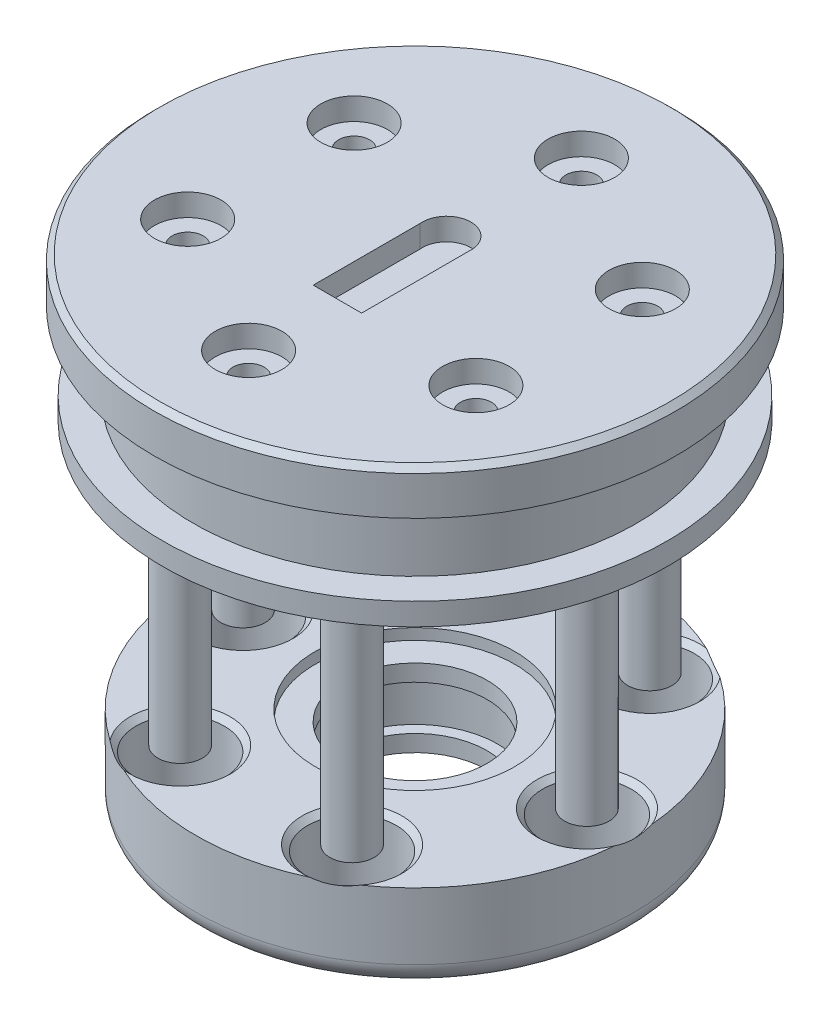
from build123d import *

# Parameters (mm, degrees)
SKETCH1_R              = 2
BOSS_EXTRUDE1_DEPTH    = 22.5
BOSS_EXTRUDE1_2_DEPTH  = 22.5
BOSS_EXTRUDE1_3_DEPTH  = 22.5
BOSS_EXTRUDE1_4_DEPTH  = 22.5
BOSS_EXTRUDE1_5_DEPTH  = 22.5
BOSS_EXTRUDE1_6_DEPTH  = 22.5
SKETCH2_R              = 19.75
SKETCH2_R_2            = 7.5
BOSS_EXTRUDE2_DEPTH    = 8
SKETCH4_R              = 7.5
SKETCH4_R_2            = 6.5
BOSS_EXTRUDE3_DEPTH    = 2.5
BOSS_EXTRUDE4_START    = -6.5
SKETCH4_2_R            = 7.5
SKETCH4_2_R_2          = 6.5
BOSS_EXTRUDE4_DEPTH    = 1.5
SKETCH5_R              = 9
CUT_EXTRUDE1_DEPTH     = 1
SKETCH6_R              = 20
BOSS_EXTRUDE5_DEPTH    = 9
SKETCH10_R             = 22.75
BOSS_EXTRUDE7_DEPTH    = 2
CUT_EXTRUDE2_START     = -4
SKETCH8_R              = 7.5
CUT_EXTRUDE2_DEPTH     = 4
SKETCH9_R              = 6
CUT_EXTRUDE3_DEPTH     = 1.5
SKETCH11_R             = 23.5
BOSS_EXTRUDE9_DEPTH    = 4
FILLET1_R              = 2
SKETCH14_R             = 4
CUT_EXTRUDE4_DEPTH     = 6
CUT_EXTRUDE6_START     = 22.5
SKETCH14_4_R           = 4
CUT_EXTRUDE6_DEPTH     = 6
CHAMFER1_SIZE          = 0.5
CHAMFER2_SIZE          = 0.5
CUT_EXTRUDE7_DEPTH     = 3
SKETCH16_R             = 1.4
CUT_EXTRUDE8_DEPTH     = 10
SKETCH17_R             = 3
CUT_EXTRUDE9_DEPTH     = 2
CIRPATTERN1_COUNT      = 6
SPLIT1_SURFACE_1_BACK  = 80.437
SPLIT1_SURFACE_1_DEPTH = 160.874
SPLIT1_SURFACE_2_BACK  = 80.437
SPLIT1_SURFACE_2_DEPTH = 160.874
CHAMFER3_SIZE          = 0.5
CUT_EXTRUDE10_DEPTH    = 2
CHAMFER4_SIZE          = 0.5
CHAMFER5_SIZE          = 0.5


with BuildPart() as part:
    # Sketch1 → Boss-Extrude1 (new body)
    with BuildSketch(Plane(origin=(0, 0, 0), x_dir=(1, 0, 0), z_dir=(0, 1, 0))):
        with Locations(Location((15.5, 0, 0), (0, 0, 90))):
            Circle(SKETCH1_R)
    extrude(amount=BOSS_EXTRUDE1_DEPTH)



with BuildPart() as body_2:
    # Sketch1 → Boss-Extrude1 2 (new body)
    with BuildSketch(Plane(origin=(0, 0, 0), x_dir=(1, 0, 0), z_dir=(0, 1, 0))):
        with Locations(Location((7.75, -13.423393759, 0), (0, 0, 90))):
            Circle(SKETCH1_R)
    extrude(amount=BOSS_EXTRUDE1_2_DEPTH)


with BuildPart() as body_3:
    # Sketch1 → Boss-Extrude1 3 (new body)
    with BuildSketch(Plane(origin=(0, 0, 0), x_dir=(1, 0, 0), z_dir=(0, 1, 0))):
        with Locations(Location((-7.75, -13.423393759, 0), (0, 0, 90))):
            Circle(SKETCH1_R)
    extrude(amount=BOSS_EXTRUDE1_3_DEPTH)


with BuildPart() as body_4:
    # Sketch1 → Boss-Extrude1 4 (new body)
    with BuildSketch(Plane(origin=(0, 0, 0), x_dir=(1, 0, 0), z_dir=(0, 1, 0))):
        with Locations(Location((-15.5, 0, 0), (0, 0, 90))):
            Circle(SKETCH1_R)
    extrude(amount=BOSS_EXTRUDE1_4_DEPTH)


with BuildPart() as body_5:
    # Sketch1 → Boss-Extrude1 5 (new body)
    with BuildSketch(Plane(origin=(0, 0, 0), x_dir=(1, 0, 0), z_dir=(0, 1, 0))):
        with Locations(Location((-7.75, 13.423393759, 0), (0, 0, 90))):
            Circle(SKETCH1_R)
    extrude(amount=BOSS_EXTRUDE1_5_DEPTH)


with BuildPart() as body_6:
    # Sketch1 → Boss-Extrude1 6 (new body)
    with BuildSketch(Plane(origin=(0, 0, 0), x_dir=(1, 0, 0), z_dir=(0, 1, 0))):
        with Locations(Location((7.75, 13.423393759, 0), (0, 0, 90))):
            Circle(SKETCH1_R)
    extrude(amount=BOSS_EXTRUDE1_6_DEPTH)


with BuildPart() as part_1:
    add(part.part)

    add(body_2.part)  # Boss-Extrude2 merges body 2

    add(body_3.part)  # Boss-Extrude2 merges body 3

    add(body_4.part)  # Boss-Extrude2 merges body 4

    add(body_5.part)  # Boss-Extrude2 merges body 5

    add(body_6.part)  # Boss-Extrude2 merges body 6
    # Sketch2 → Boss-Extrude2 (add)
    with BuildSketch(Plane.XZ):
        with Locations(Location((0, 0, 0), (0, 0, 270))):
            Circle(SKETCH2_R)
        with Locations(Location((0, 0, 0), (0, 0, 270))):
            Circle(SKETCH2_R_2, mode=Mode.SUBTRACT)
    extrude(amount=BOSS_EXTRUDE2_DEPTH)

    # Sketch4 → Boss-Extrude3 (add)
    with BuildSketch(Plane(origin=(0, 0, 0), x_dir=(1, 0, 0), z_dir=(0, 1, 0))):
        with Locations(Location((0, 0, 0), (0, 0, 270))):
            Circle(SKETCH4_R)
        with Locations(Location((0, 0, 0), (0, 0, 270))):
            Circle(SKETCH4_R_2, mode=Mode.SUBTRACT)
    extrude(amount=-BOSS_EXTRUDE3_DEPTH)

    # Sketch4<2> → Boss-Extrude4 (add)
    with BuildSketch(Plane(origin=(0, 0, 0), x_dir=(1, 0, 0), z_dir=(0, 1, 0)).offset(BOSS_EXTRUDE4_START)):
        with Locations(Location((0, 0, 0), (0, 0, 270))):
            Circle(SKETCH4_2_R)
        with Locations(Location((0, 0, 0), (0, 0, 270))):
            Circle(SKETCH4_2_R_2, mode=Mode.SUBTRACT)
    extrude(amount=-BOSS_EXTRUDE4_DEPTH)

    # Sketch5 → Cut-Extrude1 (cut)
    with BuildSketch(Plane(origin=(0, 0, 0), x_dir=(1, 0, 0), z_dir=(0, 1, 0))):
        with Locations(Location((0, 0, 0), (0, 0, 270))):
            Circle(SKETCH5_R)
    extrude(amount=-CUT_EXTRUDE1_DEPTH, mode=Mode.SUBTRACT)

    # Sketch6 → Boss-Extrude5 (add)
    with BuildSketch(Plane(origin=(0, 22.5, 0), x_dir=(1, 0, 0), z_dir=(0, 1, 0))):
        with Locations(Location((0, 0, 0), (0, 0, 270))):
            Circle(SKETCH6_R)
    extrude(amount=BOSS_EXTRUDE5_DEPTH)

    # Sketch10 → Boss-Extrude7 (add)
    with BuildSketch(Plane.XZ.offset(-22.5)):
        with Locations(Location((0, 0, 0), (0, 0, 270))):
            Circle(SKETCH10_R)
    extrude(amount=-BOSS_EXTRUDE7_DEPTH)

    # Sketch8 → Cut-Extrude2 (cut)
    with BuildSketch(Plane.XZ.offset(-22.5).offset(CUT_EXTRUDE2_START)):
        with Locations(Location((0, 0, 0), (0, 0, 90))):
            Circle(SKETCH8_R)
    extrude(amount=CUT_EXTRUDE2_DEPTH, mode=Mode.SUBTRACT)

    # Sketch9 → Cut-Extrude3 (cut)
    with BuildSketch(Plane.XZ.offset(-26.5)):
        with Locations(Location((0, 0, 0), (0, 0, 270))):
            Circle(SKETCH9_R)
    extrude(amount=-CUT_EXTRUDE3_DEPTH, mode=Mode.SUBTRACT)

    # Sketch11 → Boss-Extrude9 (add)
    with BuildSketch(Plane(origin=(0, 31.5, 0), x_dir=(1, 0, 0), z_dir=(0, 1, 0))):
        with Locations(Location((0, 0, 0), (0, 0, 270))):
            Circle(SKETCH11_R)
    extrude(amount=BOSS_EXTRUDE9_DEPTH)

    # Fillet1
    fillet1_edges = [part_1.edges().sort_by_distance(p)[0] for p in [
        (0, -8, 19.75),
    ]]
    fillet(fillet1_edges, radius=FILLET1_R)

    # Sketch14 → Cut-Extrude4 (cut)
    with BuildSketch(Plane(origin=(0, 0, 0), x_dir=(1, 0, 0), z_dir=(0, 1, 0))):
        with Locations(Location((15.5, 0, 0), (0, 0, 270))):
            Circle(SKETCH14_R)
        with Locations(Location((7.75, -13.423393759, 0), (0, 0, 270))):
            Circle(SKETCH14_R)
        with Locations(Location((-7.75, -13.423393759, 0), (0, 0, 270))):
            Circle(SKETCH14_R)
        with Locations(Location((-15.5, 0, 0), (0, 0, 270))):
            Circle(SKETCH14_R)
        with Locations(Location((-7.75, 13.423393759, 0), (0, 0, 270))):
            Circle(SKETCH14_R)
        with Locations(Location((7.75, 13.423393759, 0), (0, 0, 270))):
            Circle(SKETCH14_R)
    extrude(amount=-CUT_EXTRUDE4_DEPTH, mode=Mode.SUBTRACT)


with BuildPart() as cut_extrude4_piece_1:
    # of the separate pieces the step leaves, piece 1, a body of its own (cut_extrude4_pieces)
    add(part_1.part.solids().sort_by_distance((-7.75, 0, -15.423393759))[0])

    # Sketch14<4> → Cut-Extrude6 (cut)
    with BuildSketch(Plane(origin=(0, 0, 0), x_dir=(1, 0, 0), z_dir=(0, 1, 0)).offset(CUT_EXTRUDE6_START)):
        with Locations(Location((15.5, 0, 0), (0, 0, 270))):
            Circle(SKETCH14_4_R)
        with Locations(Location((7.75, -13.423393759, 0), (0, 0, 270))):
            Circle(SKETCH14_4_R)
        with Locations(Location((-7.75, -13.423393759, 0), (0, 0, 270))):
            Circle(SKETCH14_4_R)
        with Locations(Location((-15.5, 0, 0), (0, 0, 270))):
            Circle(SKETCH14_4_R)
        with Locations(Location((-7.75, 13.423393759, 0), (0, 0, 270))):
            Circle(SKETCH14_4_R)
        with Locations(Location((7.75, 13.423393759, 0), (0, 0, 270))):
            Circle(SKETCH14_4_R)
    extrude(amount=CUT_EXTRUDE6_DEPTH, mode=Mode.SUBTRACT)


with BuildPart() as cut_extrude4_piece_2:
    # of the separate pieces the step leaves, piece 2, a body of its own (cut_extrude4_pieces)
    add(part_1.part.solids().sort_by_distance((0, -6, -19.75))[0])

    # Chamfer1
    # the kernel refuses this chamfer: 0.5 mm, written as the material it takes off along each edge
    with BuildSketch(Plane(origin=(7.75, 0, -13.423393759), x_dir=(0, 0, 1), z_dir=(-1, 0, 0))) as chamfer1_piece_1:
        Polygon((4 + CHAMFER1_SIZE, 0), (4, -CHAMFER1_SIZE), (4, 0), align=None)
    revolve(axis=Axis((7.75, 0, -13.423393759), (0, 1, 0)), mode=Mode.SUBTRACT)
    with BuildSketch(Plane(origin=(-7.75, 0, -13.423393759), x_dir=(0, 0, 1), z_dir=(-1, 0, 0))) as chamfer1_piece_2:
        Polygon((4 + CHAMFER1_SIZE, 0), (4, -CHAMFER1_SIZE), (4, 0), align=None)
    revolve(axis=Axis((-7.75, 0, -13.423393759), (0, 1, 0)), mode=Mode.SUBTRACT)
    with BuildSketch(Plane(origin=(-15.5, 0, 0), x_dir=(0, 0, 1), z_dir=(-1, 0, 0))) as chamfer1_piece_3:
        Polygon((4 + CHAMFER1_SIZE, 0), (4, -CHAMFER1_SIZE), (4, 0), align=None)
    revolve(axis=Axis((-15.5, 0, 0), (0, 1, 0)), mode=Mode.SUBTRACT)
    with BuildSketch(Plane(origin=(-7.75, 0, 13.423393759), x_dir=(0, 0, 1), z_dir=(-1, 0, 0))) as chamfer1_piece_4:
        Polygon((4 + CHAMFER1_SIZE, 0), (4, -CHAMFER1_SIZE), (4, 0), align=None)
    revolve(axis=Axis((-7.75, 0, 13.423393759), (0, 1, 0)), mode=Mode.SUBTRACT)
    with BuildSketch(Plane(origin=(7.75, 0, 13.423393759), x_dir=(0, 0, 1), z_dir=(-1, 0, 0))) as chamfer1_piece_5:
        Polygon((4 + CHAMFER1_SIZE, 0), (4, -CHAMFER1_SIZE), (4, 0), align=None)
    revolve(axis=Axis((7.75, 0, 13.423393759), (0, 1, 0)), mode=Mode.SUBTRACT)
    with BuildSketch(Plane(origin=(15.5, 0, 0), x_dir=(0, 0, 1), z_dir=(-1, 0, 0))) as chamfer1_piece_6:
        Polygon((4 + CHAMFER1_SIZE, 0), (4, -CHAMFER1_SIZE), (4, 0), align=None)
    revolve(axis=Axis((15.5, 0, 0), (0, 1, 0)), mode=Mode.SUBTRACT)


with BuildPart() as cut_extrude6_piece_1:
    # of the separate pieces the step leaves, piece 1, a body of its own (cut_extrude6_pieces)
    add(cut_extrude4_piece_1.part.solids().sort_by_distance((0, 22.5, -22.75))[0])

    # Chamfer2
    chamfer2_edges = [cut_extrude6_piece_1.edges().sort_by_distance(p)[0] for p in [
        (-7.75, 22.5, 9.423393759),
        (-15.5, 22.5, -4),
        (-7.75, 22.5, -17.423393759),
        (7.75, 22.5, -17.423393759),
        (15.5, 22.5, -4),
        (7.75, 22.5, 9.423393759),
    ]]
    chamfer(chamfer2_edges, length=CHAMFER2_SIZE)

    # Sketch15 → Cut-Extrude7 (cut)
    with BuildSketch(Plane.XZ.offset(-22.5)):
        Polygon((9.790381057, 5.652479139), (12.990381057, 3.804958277), (16.190381057, 5.652479139), (16.190381057, 9.347520861), (12.990381057, 11.195041723), (9.790381057, 9.347520861), align=None)
    cut_extrude7 = extrude(amount=-CUT_EXTRUDE7_DEPTH, mode=Mode.SUBTRACT)

    # Sketch16 → Cut-Extrude8 (cut)
    with BuildSketch(Plane.XZ.offset(-25.5)):
        with Locations(Location((12.990381057, 7.5, 0), (0, 0, 270))):
            Circle(SKETCH16_R)
    cut_extrude8 = extrude(amount=-CUT_EXTRUDE8_DEPTH, mode=Mode.SUBTRACT)

    # Sketch17 → Cut-Extrude9 (cut)
    with BuildSketch(Plane(origin=(0, 35.5, 0), x_dir=(1, 0, 0), z_dir=(0, 1, 0))):
        with Locations(Location((12.990381057, -7.5, 0), (0, 0, 270))):
            Circle(SKETCH17_R)
    cut_extrude9 = extrude(amount=-CUT_EXTRUDE9_DEPTH, mode=Mode.SUBTRACT)

    # CirPattern1: Cut-Extrude7, Cut-Extrude8, Cut-Extrude9 ×6 about axis
    cirpattern1_axis = Axis((0, 0, 0), (0, 1, 0))
    add([cut_extrude7.rotate(cirpattern1_axis, i * 360 / CIRPATTERN1_COUNT) for i in range(1, CIRPATTERN1_COUNT)], mode=Mode.SUBTRACT)
    add([cut_extrude8.rotate(cirpattern1_axis, i * 360 / CIRPATTERN1_COUNT) for i in range(1, CIRPATTERN1_COUNT)], mode=Mode.SUBTRACT)
    add([cut_extrude9.rotate(cirpattern1_axis, i * 360 / CIRPATTERN1_COUNT) for i in range(1, CIRPATTERN1_COUNT)], mode=Mode.SUBTRACT)


with BuildPart() as cut_extrude6_piece_2:
    # of the separate pieces the step leaves, piece 2, a body of its own (cut_extrude6_pieces)
    add(cut_extrude4_piece_1.part.solids().sort_by_distance((15.5, 0, -2))[0])


with BuildPart() as cut_extrude6_piece_3:
    # of the separate pieces the step leaves, piece 3, a body of its own (cut_extrude6_pieces)
    add(cut_extrude4_piece_1.part.solids().sort_by_distance((-7.75, 0, 11.423393759))[0])


with BuildPart() as cut_extrude6_piece_4:
    # of the separate pieces the step leaves, piece 4, a body of its own (cut_extrude6_pieces)
    add(cut_extrude4_piece_1.part.solids().sort_by_distance((-7.75, 0, -15.423393759))[0])


with BuildPart() as cut_extrude6_piece_5:
    # of the separate pieces the step leaves, piece 5, a body of its own (cut_extrude6_pieces)
    add(cut_extrude4_piece_1.part.solids().sort_by_distance((7.75, 0, 11.423393759))[0])


with BuildPart() as cut_extrude6_piece_6:
    # of the separate pieces the step leaves, piece 6, a body of its own (cut_extrude6_pieces)
    add(cut_extrude4_piece_1.part.solids().sort_by_distance((7.75, 0, -15.423393759))[0])


with BuildPart() as cut_extrude6_piece_7:
    # of the separate pieces the step leaves, piece 7, a body of its own (cut_extrude6_pieces)
    add(cut_extrude4_piece_1.part.solids().sort_by_distance((-15.5, 0, -2))[0])


with BuildPart() as body_9:
    # Split1: the piece behind the surface
    add(cut_extrude6_piece_1.part)
    # Split1 surface: a surface, the sketch's curves swept straight by 160.874 mm
    with BuildLine(Plane.XY.offset(-SPLIT1_SURFACE_1_BACK), mode=Mode.PRIVATE) as split1_surface_1_path:
        Line((-58.318961136, 31.5), (42.618963332, 31.5))
    split1_surface_1 = Shell.extrude(split1_surface_1_path.wire(), (0 * SPLIT1_SURFACE_1_DEPTH, 0 * SPLIT1_SURFACE_1_DEPTH, 1 * SPLIT1_SURFACE_1_DEPTH))
    split(bisect_by=split1_surface_1, keep=Keep.BOTTOM)

    # Chamfer3
    chamfer3_edges = [body_9.edges().sort_by_distance(p)[0] for p in [
        (0, 31.5, -20),
    ]]
    chamfer(chamfer3_edges, length=CHAMFER3_SIZE)

    # Chamfer5
    chamfer5_edges = [body_9.edges().sort_by_distance(p)[0] for p in [
        (0, 22.5, -7.5),
    ]]
    chamfer(chamfer5_edges, length=CHAMFER5_SIZE)


with BuildPart() as cut_extrude6_piece_1_1:
    add(cut_extrude6_piece_1.part)

    # Split1: split by a surface, the side it looks to stays
    # Split1 surface: a surface, the sketch's curves swept straight by 160.874 mm
    with BuildLine(Plane.XY.offset(-SPLIT1_SURFACE_2_BACK), mode=Mode.PRIVATE) as split1_surface_2_path:
        Line((-58.318961136, 31.5), (42.618963332, 31.5))
    split1_surface_2 = Shell.extrude(split1_surface_2_path.wire(), (0 * SPLIT1_SURFACE_2_DEPTH, 0 * SPLIT1_SURFACE_2_DEPTH, 1 * SPLIT1_SURFACE_2_DEPTH))
    split(bisect_by=split1_surface_2, keep=Keep.TOP)

    # Sketch19 → Cut-Extrude10 (cut)
    with BuildSketch(Plane(origin=(0, 35.5, 0), x_dir=(1, 0, 0), z_dir=(0, 1, 0))):
        with BuildLine():
            Line((2.180588744, -6.994943658), (-2.180588744, -6.994943658))
            Line((-2.180588744, -6.994943658), (-2.180588744, 2.614058785))
            ThreePointArc((-2.180588744, 2.614058785), (0, 5.040500452), (2.180588744, 2.614058785))
            Line((2.180588744, 2.614058785), (2.180588744, -6.994943658))
        make_face()
    extrude(amount=-CUT_EXTRUDE10_DEPTH, mode=Mode.SUBTRACT)

    # Chamfer4
    chamfer4_edges = [cut_extrude6_piece_1_1.edges().sort_by_distance(p)[0] for p in [
        (0, 35.5, -23.5),
    ]]
    chamfer(chamfer4_edges, length=CHAMFER4_SIZE)


solid = Compound([cut_extrude4_piece_2.part, cut_extrude6_piece_2.part, cut_extrude6_piece_3.part, cut_extrude6_piece_4.part, cut_extrude6_piece_5.part, cut_extrude6_piece_6.part, cut_extrude6_piece_7.part, body_9.part, cut_extrude6_piece_1_1.part])
